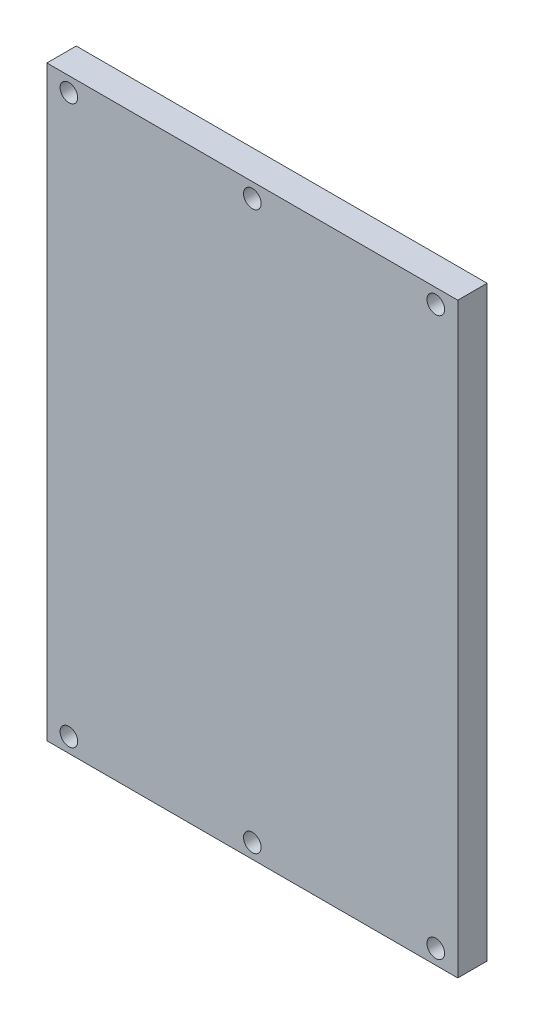
from build123d import *

# Parameters (mm, degrees)
SKETCH1_W           = 70
SKETCH1_H           = 100
BOSS_EXTRUDE1_DEPTH = 2.5
SKETCH2_R           = 1.5
CUT_EXTRUDE1_DEPTH  = 11


with BuildPart() as part:
    # Sketch1 → Boss-Extrude1 (new, symmetric)
    with BuildSketch(Plane.XY):
        Rectangle(SKETCH1_W, SKETCH1_H)
    extrude(amount=BOSS_EXTRUDE1_DEPTH, both=True)

    # Sketch2 → Cut-Extrude1 (cut)
    with BuildSketch(Plane.XY.offset(2.5)):
        with Locations((0, 47.5)):
            Circle(SKETCH2_R)
        with Locations((-31.25, 47.5)):
            Circle(SKETCH2_R)
        with Locations((31.25, 47.5)):
            Circle(SKETCH2_R)
    cut_extrude1 = extrude(amount=-CUT_EXTRUDE1_DEPTH, mode=Mode.SUBTRACT)

    # Mirror1: Cut-Extrude1 across plane
    add(cut_extrude1.mirror(Plane.ZX), mode=Mode.SUBTRACT)


solid = part.part
